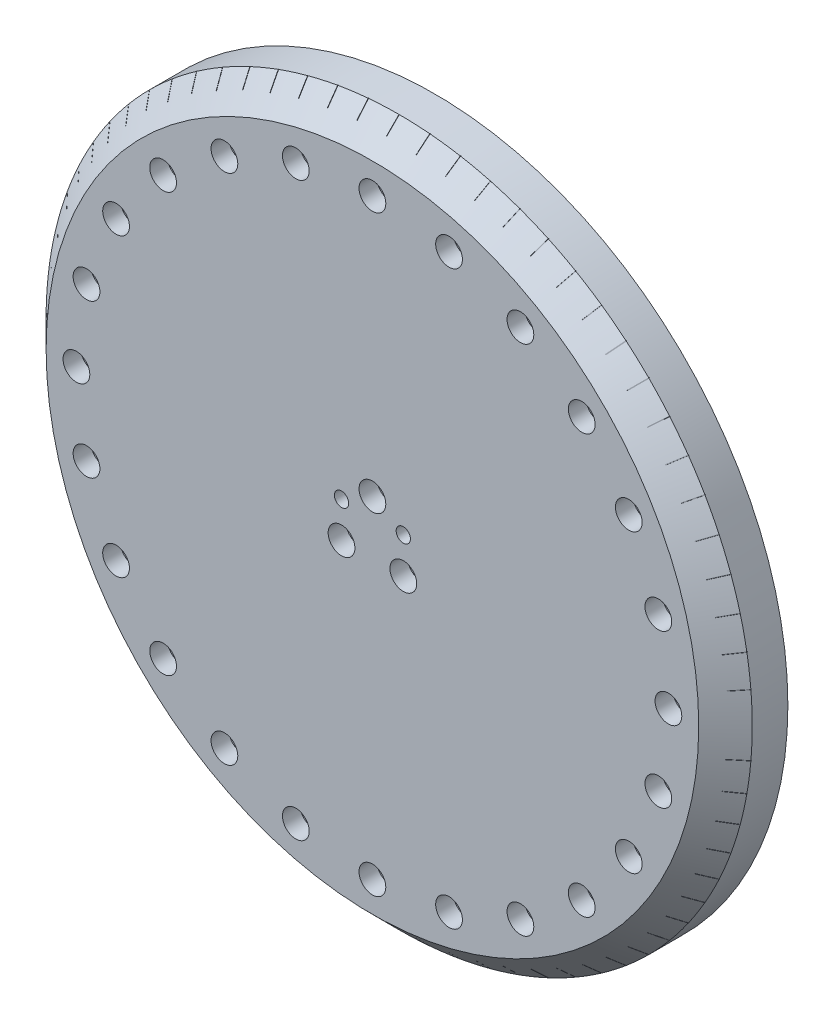
from build123d import *

# Parameters (mm, degrees)
ESBO_O1_R                                            = 198
RESSALTO_EXTRUS_O1_DEPTH                             = 35
CHANFRO1_SIZE                                        = 15
REBAIXO_PARA_PARAFUSO_ALLEN_SEXTAVADO_DE_D           = 9
REBAIXO_PARA_PARAFUSO_ALLEN_SEXTAVADO_DE_CBORE_D     = 15
REBAIXO_PARA_PARAFUSO_ALLEN_SEXTAVADO_DE_CBORE_DEPTH = 10
PADR_OCIRCULAR1_COUNT                                = 24
ESBO_O7_R                                            = 30
CORTE_EXTRUS_O1_DEPTH                                = 10
REBAIXO_PARA_PARAFUSO_ALLEN_SEXTAVAD_2_D             = 9
REBAIXO_PARA_PARAFUSO_ALLEN_SEXTAVAD_2_CBORE_D       = 15
REBAIXO_PARA_PARAFUSO_ALLEN_SEXTAVAD_2_CBORE_DEPTH   = 10
FUROS_GUIA_COM_8_0MM1_D                              = 8
CORTE_EXTRUS_O2_DEPTH                                = 0.2
PADR_OCIRCULAR2_COUNT                                = 72


with BuildPart() as part:
    # Esboço1 → Ressalto-extrusão1 (new body)
    with BuildSketch(Plane.XY):
        with Locations((0, 235)):
            Circle(ESBO_O1_R)
    extrude(amount=RESSALTO_EXTRUS_O1_DEPTH)

    # Chanfro1
    chanfro1_edges = [part.edges().sort_by_distance(p)[0] for p in [
        (-198, 235, 35),
    ]]
    chamfer(chanfro1_edges, length=CHANFRO1_SIZE)

    # Rebaixo para parafuso Allen sextavado de (through all)
    with Locations(Plane.XY.offset(35)):
        with Locations((0, 69)):
            rebaixo_para_parafuso_allen_sextavado_de = CounterBoreHole(REBAIXO_PARA_PARAFUSO_ALLEN_SEXTAVADO_DE_D / 2, REBAIXO_PARA_PARAFUSO_ALLEN_SEXTAVADO_DE_CBORE_D / 2, REBAIXO_PARA_PARAFUSO_ALLEN_SEXTAVADO_DE_CBORE_DEPTH)

    # PadrãoCircular1: Rebaixo para parafuso Allen sextavado de ×24 about axis
    padr_ocircular1_axis = Axis((0, 235, 20), (0, 0, -1))
    for i in range(1, PADR_OCIRCULAR1_COUNT):
        add(rebaixo_para_parafuso_allen_sextavado_de.rotate(padr_ocircular1_axis, i * 360 / PADR_OCIRCULAR1_COUNT), mode=Mode.SUBTRACT)

    # Esboço7 → Corte-extrusão1 (cut)
    with BuildSketch(Plane(origin=(0, 0, 0), x_dir=(-1, 0, 0), z_dir=(0, 0, -1))):
        with Locations((0, 235.03907896)):
            Circle(ESBO_O7_R)
    extrude(amount=-CORTE_EXTRUS_O1_DEPTH, mode=Mode.SUBTRACT)

    # Rebaixo para parafuso Allen sextavad 2 (through all)
    with Locations(Plane.XY.offset(35)):
        with Locations((0, 255), (-17.320508076, 225), (17.320508076, 225)):
            CounterBoreHole(REBAIXO_PARA_PARAFUSO_ALLEN_SEXTAVAD_2_D / 2, REBAIXO_PARA_PARAFUSO_ALLEN_SEXTAVAD_2_CBORE_D / 2, REBAIXO_PARA_PARAFUSO_ALLEN_SEXTAVAD_2_CBORE_DEPTH)

    # Furos-guia com Ø8.0mm1 (through all)
    with Locations(Plane.XY.offset(35)):
        with Locations((-17.320508076, 245), (17.320508076, 245)):
            Hole(FUROS_GUIA_COM_8_0MM1_D / 2)

    # Esboço15 → Corte-extrusão2 (cut)
    with BuildSketch(Plane(origin=(0, 8.5, -8.5), x_dir=(-1, 0, 0), z_dir=(0, -0.7071067811865481, 0.7071067811865469))):
        Polygon((0.1, -50.305086528), (-0.1, -50.305086528), (-0.1, -40.305086528), (-0.1, -37.305086528), (0.1, -37.305086528), (0.1, -40.305086528), align=None)
    corte_extrus_o2 = extrude(amount=-CORTE_EXTRUS_O2_DEPTH, mode=Mode.SUBTRACT)

    # PadrãoCircular2: Corte-extrusão2 ×72 about axis
    padr_ocircular2_axis = Axis((0, 235, 20), (0, 0, -1))
    for i in range(1, PADR_OCIRCULAR2_COUNT):
        add(corte_extrus_o2.rotate(padr_ocircular2_axis, i * 360 / PADR_OCIRCULAR2_COUNT), mode=Mode.SUBTRACT)


solid = part.part
